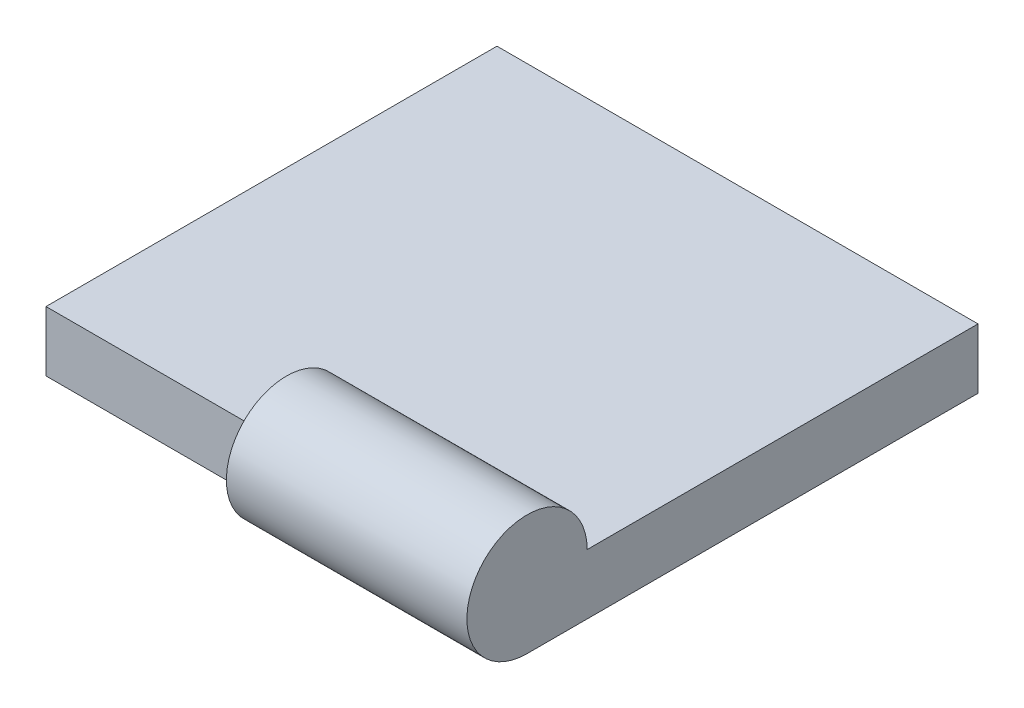
from build123d import *

# Parameters (mm, degrees)
SKETCH1_W           = 16
SKETCH1_H           = 15
BOSS_EXTRUDE1_DEPTH = 2
SKETCH2_R           = 2
BOSS_EXTRUDE2_DEPTH = 8


with BuildPart() as part:
    # Sketch1 → Boss-Extrude1 (new body)
    with BuildSketch(Plane(origin=(0, 0, 0), x_dir=(1, 0, 0), z_dir=(0, 1, 0))):
        with Locations((10.069631841, -165.54341444)):
            Rectangle(SKETCH1_W, SKETCH1_H)
    extrude(amount=BOSS_EXTRUDE1_DEPTH)

    # Sketch2 → Boss-Extrude2 (add)
    with BuildSketch(Plane(origin=(18.069631841, 0, 0), x_dir=(0, 0, -1), z_dir=(1, 0, 0))):
        with Locations((-173.04341444, 2)):
            Circle(SKETCH2_R)
    extrude(amount=-BOSS_EXTRUDE2_DEPTH)


solid = part.part
